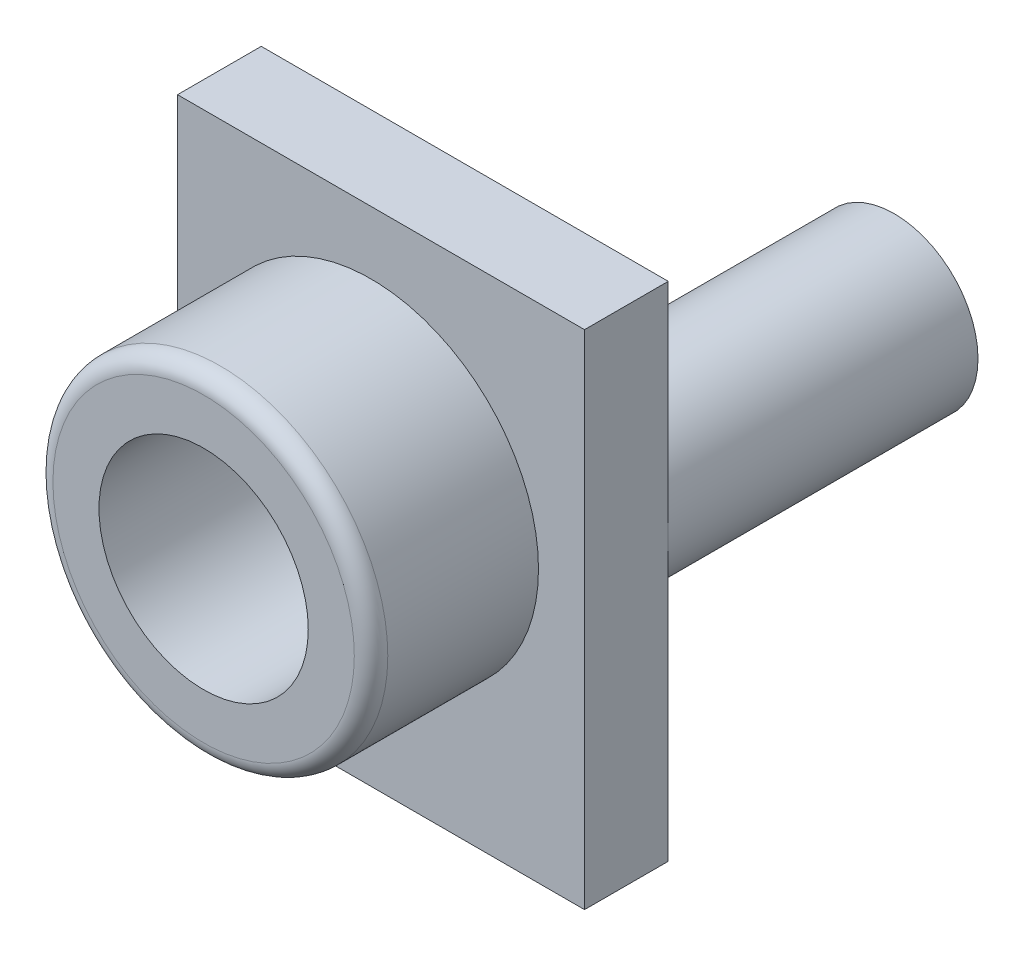
from build123d import *

# Parameters (mm, degrees)
SKETCH_2_W          = 9.723167254
SKETCH_2_H          = 12
EXTRUDE_1_DEPTH     = 2
SKETCH_3_R          = 4
SKETCH_3_R_2        = 2.5
EXTRUDE_2_DEPTH     = 4
SKETCH_4_R          = 2
EXTRUDE_3_DEPTH     = 7.4
FILLET_1_R          = 0.4
SKETCH_5_R          = 1.1
CUT_EXTRUDE_1_DEPTH = 2


with BuildPart() as part:
    # Эскиз2 → Бобышка-Вытянуть1 (new body)
    with BuildSketch(Plane.XY):
        Rectangle(SKETCH_2_W, SKETCH_2_H)
    extrude(amount=EXTRUDE_1_DEPTH)

    # Эскиз3 → Бобышка-Вытянуть2 (add)
    with BuildSketch(Plane.XY.offset(2)):
        with Locations((-0.238416373, 0.5)):
            Circle(SKETCH_3_R)
        with Locations((-0.238416373, 0.5)):
            Circle(SKETCH_3_R_2, mode=Mode.SUBTRACT)
    extrude(amount=EXTRUDE_2_DEPTH)

    # Эскиз4 → Бобышка-Вытянуть3 (add)
    with BuildSketch(Plane(origin=(0, 0, 0), x_dir=(-1, 0, 0), z_dir=(0, 0, -1))):
        with Locations((-2.861583627, 0.7)):
            Circle(SKETCH_4_R)
    extrude(amount=EXTRUDE_3_DEPTH)

    # Скругление1
    fillet_1_edges = [part.edges().sort_by_distance(p)[0] for p in [
        (-4.238416373, 0.5, 6),
    ]]
    fillet(fillet_1_edges, radius=FILLET_1_R)

    # Эскиз5 → Вырез-Вытянуть1 (cut)
    with BuildSketch(Plane.XY.offset(2)):
        with Locations((-0.238416373, 0.5)):
            Circle(SKETCH_5_R)
    extrude(amount=-CUT_EXTRUDE_1_DEPTH, mode=Mode.SUBTRACT)


solid = part.part
